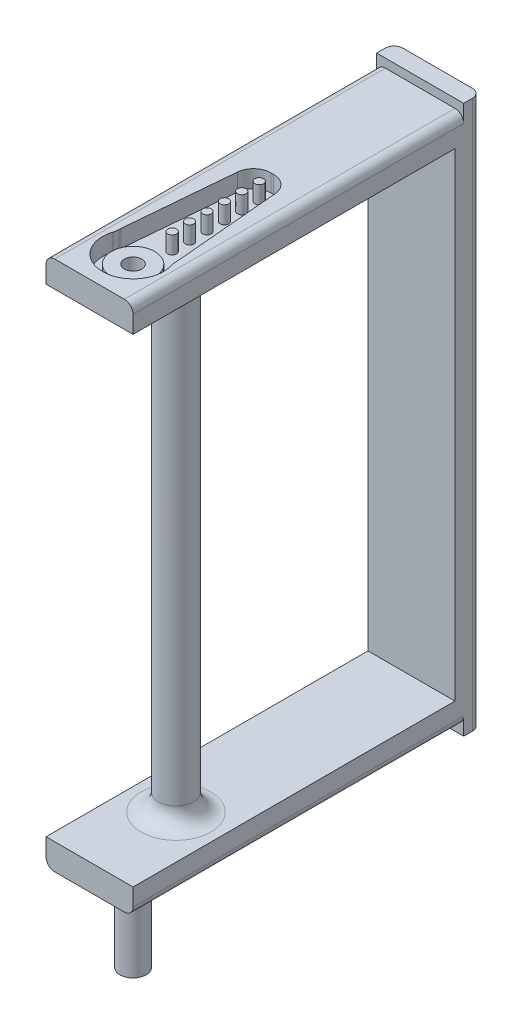
from build123d import *

# Parameters (mm, degrees)
SKETCH1_W             = 10
SKETCH1_H             = 40
BOSS_EXTRUDE1_DEPTH   = 3
CAVITY4_START         = 1
CAVITY4_OUTLINE_R     = 2.5
CAVITY4_OUTLINE_R_2   = 0.5
CAVITY4_DEPTH         = 2
CAVITY4_START_2       = 2
CAVITY4_2_OUTLINE_R   = 2.5
CAVITY4_2_OUTLINE_R_2 = 1
CAVITY4_2_DEPTH       = 1
CUT_EXTRUDE4_START    = -23
SKETCH5_R             = 1
CUT_EXTRUDE4_DEPTH    = 23
SKETCH7_W             = 10
SKETCH7_H             = 3
BOSS_EXTRUDE3_DEPTH   = 55
SKETCH8_R             = 1.5
BOSS_EXTRUDE4_DEPTH   = 10
SKETCH9_W             = 10
SKETCH9_H             = 2
BOSS_EXTRUDE5_DEPTH   = 1
FILLET2_R             = 1
FILLET3_R             = 1
FILLET4_R             = 2
SKETCH10_R            = 2
BOSS_EXTRUDE6_DEPTH   = 55
FILLET5_R             = 2
FILLET6_R             = 1


# Read off the part's stored shape, not the designer's step: Cavity4
with BuildPart() as part:
    # Sketch1 → Boss-Extrude1 (new body)
    with BuildSketch(Plane(origin=(0, 0, 0), x_dir=(1, 0, 0), z_dir=(0, 1, 0))):
        with Locations((1.621359223, -14.684466019)):
            Rectangle(SKETCH1_W, SKETCH1_H)
    boss_extrude1 = extrude(amount=BOSS_EXTRUDE1_DEPTH)

    # Cavity4 outline → Cavity4 (cut)
    with BuildSketch(Plane(origin=(0, 0, 0), x_dir=(1, 0, 0), z_dir=(0, 1, 0)).offset(CAVITY4_START)):
        with BuildLine():
            Line((-0.538748891, -15.509698524), (-1.620990225, -27.847249725))
            ThreePointArc((-1.620990225, -27.847249725), (-1.626727223, -27.934549786), (-1.628640777, -28.022017221))
            Line((-1.628640777, -28.022017221), (-1.628640777, -28.045106388))
            ThreePointArc((-1.628640777, -28.045106388), (-1.65149867, -28.346617733), (-1.719549868, -28.641237163))
            ThreePointArc((-1.719549868, -28.641237163), (1.621359223, -33.184466019), (4.962268314, -28.641237163))
            ThreePointArc((4.962268314, -28.641237163), (4.894217117, -28.346617733), (4.871359223, -28.045106388))
            Line((4.871359223, -28.045106388), (4.871359223, -28.022017221))
            ThreePointArc((4.871359223, -28.022017221), (4.86944567, -27.934549786), (4.863708671, -27.847249725))
            Line((4.863708671, -27.847249725), (3.781467338, -15.509698524))
            ThreePointArc((3.781467338, -15.509698524), (3.14012955, -14.209756728), (1.78911789, -13.684466019))
            Line((1.78911789, -13.684466019), (1.453600557, -13.684466019))
            ThreePointArc((1.453600557, -13.684466019), (0.102588897, -14.209756728), (-0.538748891, -15.509698524))
        make_face()
        with Locations((1.621359223, -29.684466019)):
            Circle(CAVITY4_OUTLINE_R, mode=Mode.SUBTRACT)
        with Locations((1.621359223, -25.184466019)):
            Circle(CAVITY4_OUTLINE_R_2, mode=Mode.SUBTRACT)
        with Locations((1.621359223, -23.184466019)):
            Circle(CAVITY4_OUTLINE_R_2, mode=Mode.SUBTRACT)
        with Locations((1.621359223, -21.184466019)):
            Circle(CAVITY4_OUTLINE_R_2, mode=Mode.SUBTRACT)
        with Locations((1.621359223, -19.184466019)):
            Circle(CAVITY4_OUTLINE_R_2, mode=Mode.SUBTRACT)
        with Locations((1.621359223, -17.184466019)):
            Circle(CAVITY4_OUTLINE_R_2, mode=Mode.SUBTRACT)
        with Locations((1.621359223, -15.184466019)):
            Circle(CAVITY4_OUTLINE_R_2, mode=Mode.SUBTRACT)
    extrude(amount=CAVITY4_DEPTH, mode=Mode.SUBTRACT)

    # Cavity4 2 outline → Cavity4 2 (cut)
    with BuildSketch(Plane(origin=(0, 0, 0), x_dir=(1, 0, 0), z_dir=(0, 1, 0)).offset(CAVITY4_START_2)):
        with Locations((1.621359223, -29.684466019)):
            Circle(CAVITY4_2_OUTLINE_R)
        with Locations((1.621359223, -29.684466019)):
            Circle(CAVITY4_2_OUTLINE_R_2, mode=Mode.SUBTRACT)
    extrude(amount=CAVITY4_2_DEPTH, mode=Mode.SUBTRACT)

    # Sketch5 → Cut-Extrude4 (cut)
    with BuildSketch(Plane(origin=(0, 3, 0), x_dir=(1, 0, 0), z_dir=(0, 1, 0)).offset(CUT_EXTRUDE4_START)):
        with Locations(Location((1.621359223, -29.684466019, 0), (0, 0, 270))):
            Circle(SKETCH5_R)
    extrude(amount=CUT_EXTRUDE4_DEPTH, mode=Mode.SUBTRACT)

    # Sketch7 → Boss-Extrude3 (add)
    with BuildSketch(Plane.XZ):
        with Locations((1.621359223, -3.815533981)):
            Rectangle(SKETCH7_W, SKETCH7_H)
    extrude(amount=BOSS_EXTRUDE3_DEPTH)

    # Mirror1: Boss-Extrude1 across plane
    add(boss_extrude1.mirror(Plane(origin=(0, -27.5, 0), x_dir=(0, 0, 1), z_dir=(0, -1, 0))))

    # Sketch8 → Boss-Extrude4 (add)
    with BuildSketch(Plane.XZ.offset(58)):
        with Locations(Location((1.621359223, 29.684466019, 0), (0, 0, 270))):
            Circle(SKETCH8_R)
    extrude(amount=BOSS_EXTRUDE4_DEPTH)

    # Sketch9 → Boss-Extrude5 (add)
    with BuildSketch(Plane.XZ.offset(58)):
        with Locations((1.621359223, -4.315533981)):
            Rectangle(SKETCH9_W, SKETCH9_H)
    boss_extrude5 = extrude(amount=BOSS_EXTRUDE5_DEPTH)

    # Mirror2: Boss-Extrude5 across plane
    add(boss_extrude5.mirror(Plane(origin=(0, -27.5, 0), x_dir=(0, 0, 1), z_dir=(0, -1, 0))))

    # Fillet2
    fillet2_edges = [part.edges().sort_by_distance(p)[0] for p in [
        (6.621359223, 3, 15.684466019),
        (6.621359223, -58, 15.684466019),
    ]]
    fillet(fillet2_edges, radius=FILLET2_R)

    # Fillet3
    fillet3_edges = [part.edges().sort_by_distance(p)[0] for p in [
        (-3.378640777, -58, 15.684466019),
        (-3.378640777, 3, 15.684466019),
    ]]
    fillet(fillet3_edges, radius=FILLET3_R)

    # Fillet4
    fillet4_edges = [part.edges().sort_by_distance(p)[0] for p in [
        (1.621359223, -58, 31.184466019),
    ]]
    fillet(fillet4_edges, radius=FILLET4_R)

    # Sketch10 → Boss-Extrude6 (add)
    with BuildSketch(Plane.XZ):
        with Locations(Location((1.621359223, 24.751865002, 0), (0, 0, 90))):
            Circle(SKETCH10_R)
    extrude(amount=BOSS_EXTRUDE6_DEPTH)

    # Fillet5
    fillet5_edges = [part.edges().sort_by_distance(p)[0] for p in [
        (1.621359223, -55, 22.751865002),
        (1.621359223, 0, 22.751865002),
    ]]
    fillet(fillet5_edges, radius=FILLET5_R)

    # Fillet6
    fillet6_edges = [part.edges().sort_by_distance(p)[0] for p in [
        (-3.378640777, -27.5, -5.315533981),
        (6.621359223, -27.5, -5.315533981),
    ]]
    fillet(fillet6_edges, radius=FILLET6_R)


solid = part.part
